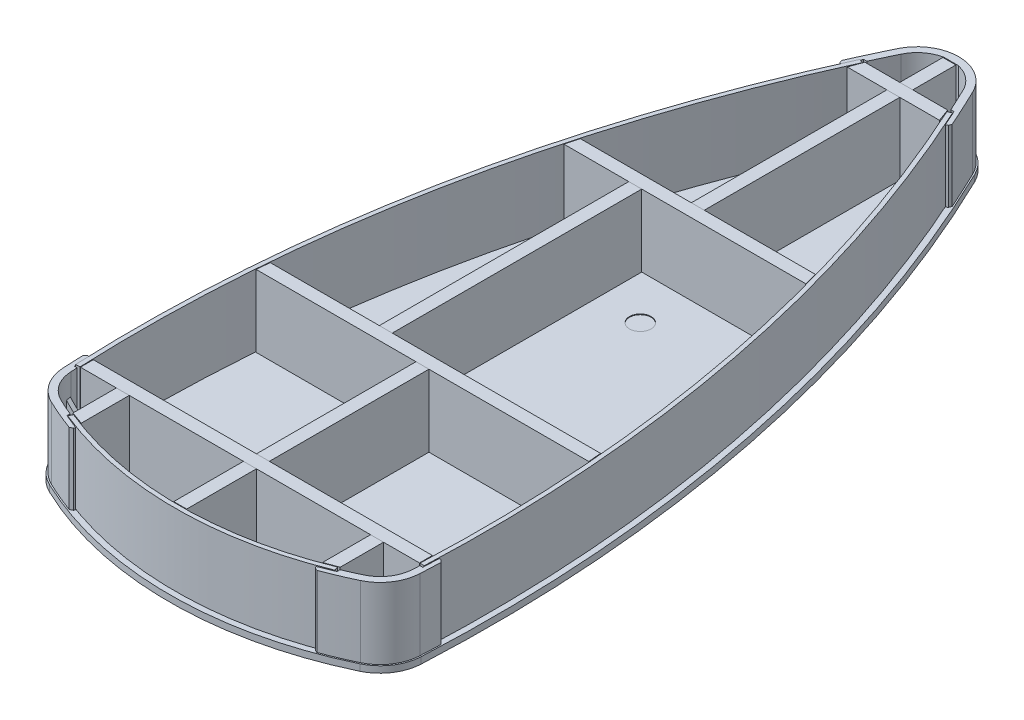
from build123d import *

# Parameters (mm, degrees)
BOSS_EXTRUDE1_DEPTH   = 9
SKETCH2_R             = 15
CUT_EXTRUDE1_DEPTH    = 1
SKETCH3_W             = 18
SKETCH3_H             = 60
BOSS_EXTRUDE2_DEPTH   = 100
BOSS_EXTRUDE3_DEPTH   = 100
BOSS_EXTRUDE3_2_DEPTH = 100
SKETCH4_W             = 471.672956284
SKETCH4_H             = 18
BOSS_EXTRUDE3_3_DEPTH = 100
BOSS_EXTRUDE3_4_DEPTH = 100
BOSS_EXTRUDE4_DEPTH   = 100
BOSS_EXTRUDE4_2_DEPTH = 100
SKETCH5_W             = 18
SKETCH5_H             = 97
BOSS_EXTRUDE4_3_DEPTH = 100
SKETCH5_H_2           = 222
BOSS_EXTRUDE4_4_DEPTH = 100
SKETCH5_H_3           = 272
BOSS_EXTRUDE4_5_DEPTH = 100
SKETCH5_H_4           = 347
BOSS_EXTRUDE4_6_DEPTH = 100
EXTRUDE_THIN1_DEPTH   = 100
EXTRUDE_THIN1_2_DEPTH = 100
EXTRUDE_THIN1_3_DEPTH = 100
BOSS_EXTRUDE5_DEPTH   = 99
CHAMFER1_SIZE         = 3
CHAMFER1_SIZE_2       = 3.015128498
BOSS_EXTRUDE9_START   = -50
SKETCH9_W             = 6
SKETCH9_H             = 13.286366455
BOSS_EXTRUDE9_DEPTH   = 20
CHAMFER3_SIZE         = 13
CUT_EXTRUDE2_REACH    = 626.467
SKETCH10_W            = 4
SKETCH10_H            = 10
BOSS_EXTRUDE8_DEPTH   = 99
CHAMFER2_SIZE         = 3
CHAMFER2_SIZE_2       = 3.128152287
BOSS_EXTRUDE10_START  = -50
SKETCH11_W            = 12
SKETCH11_H            = 6
SKETCH11_W_2          = 6
SKETCH11_H_2          = 12
BOSS_EXTRUDE10_DEPTH  = 20
CHAMFER4_SIZE         = 12
SKETCH12_W            = 4
SKETCH12_H            = 10
CUT_EXTRUDE3_DEPTH    = 6
SKETCH13_W            = 4
SKETCH13_H            = 10
CUT_EXTRUDE4_DEPTH    = 6


with BuildPart() as part:
    # Sketch1 → Boss-Extrude1 (new body)
    with BuildSketch(Plane(origin=(0, 0, 0), x_dir=(1, 0, 0), z_dir=(0, 1, 0))):
        with BuildLine():
            ThreePointArc((-54.052143505, 516.045456082), (0, 550), (54.052143505, 516.045456082))
            ThreePointArc((54.052143505, 516.045456082), (212.411110101, 45.380156813), (249.928432165, -449.792375526))
            ThreePointArc((249.928432165, -449.792375526), (239.970710869, -480.073057321), (215.909090909, -500.980337113))
            ThreePointArc((215.909090909, -500.980337113), (0, -550), (-215.909090909, -500.980337113))
            ThreePointArc((-215.909090909, -500.980337113), (-239.970710869, -480.073057321), (-249.928432165, -449.792375526))
            ThreePointArc((-249.928432165, -449.792375526), (-212.411110101, 45.380156813), (-54.052143505, 516.045456082))
        make_face()
    extrude(amount=-BOSS_EXTRUDE1_DEPTH)

    # Sketch2 → Cut-Extrude1 (cut)
    with BuildSketch(Plane(origin=(0, 0, 0), x_dir=(1, 0, 0), z_dir=(0, 1, 0))):
        with Locations(Location((0, 105, 0), (0, 0, 270))):
            Circle(SKETCH2_R)
        with Locations(Location((0, -120, 0), (0, 0, 270))):
            Circle(SKETCH2_R)
    extrude(amount=-CUT_EXTRUDE1_DEPTH, mode=Mode.SUBTRACT)


with BuildPart() as body_2:
    # Sketch3 → Boss-Extrude2 (new body)
    with BuildSketch(Plane(origin=(0, 0, 0), x_dir=(1, 0, 0), z_dir=(0, 1, 0))):
        with Locations((0, 505)):
            Rectangle(SKETCH3_W, SKETCH3_H)
    extrude(amount=BOSS_EXTRUDE2_DEPTH)


with BuildPart() as body_3:
    # Sketch4 → Boss-Extrude3 (new body)
    with BuildSketch(Plane(origin=(0, 0, 0), x_dir=(1, 0, 0), z_dir=(0, 1, 0))):
        Polygon((-57.641979484, 475), (57.641979484, 475), (64.1934437, 457), (-64.1934437, 457), align=None)
    extrude(amount=BOSS_EXTRUDE3_DEPTH)


with BuildPart() as body_4:
    # Sketch4 → Boss-Extrude3 2 (new body)
    with BuildSketch(Plane(origin=(0, 0, 0), x_dir=(1, 0, 0), z_dir=(0, 1, 0))):
        Polygon((-229.811806881, -180), (229.811806881, -180), (231.386602824, -198), (-231.386602824, -198), align=None)
    extrude(amount=BOSS_EXTRUDE3_2_DEPTH)


with BuildPart() as body_5:
    # Sketch4 → Boss-Extrude3 3 (new body)
    with BuildSketch(Plane(origin=(0, 0, 0), x_dir=(1, 0, 0), z_dir=(0, 1, 0))):
        with Locations((0, -429)):
            Rectangle(SKETCH4_W, SKETCH4_H)
    extrude(amount=BOSS_EXTRUDE3_3_DEPTH)


with BuildPart() as body_6:
    # Sketch4 → Boss-Extrude3 4 (new body)
    with BuildSketch(Plane(origin=(0, 0, 0), x_dir=(1, 0, 0), z_dir=(0, 1, 0))):
        Polygon((-163.354493959, 185), (163.354493959, 185), (168.177579423, 167), (-168.177579423, 167), align=None)
    extrude(amount=BOSS_EXTRUDE3_4_DEPTH)


with BuildPart() as body_7:
    # Sketch5 → Boss-Extrude4 (new body)
    with BuildSketch(Plane(origin=(0, 0, 0), x_dir=(1, 0, 0), z_dir=(0, 1, 0))):
        Polygon((-185.836478142, -438), (-167.836478142, -438), (-167.836478142, -504.892797934), (-185.836478142, -498.341333717), align=None)
    extrude(amount=BOSS_EXTRUDE4_DEPTH)


with BuildPart() as body_8:
    # Sketch5 → Boss-Extrude4 2 (new body)
    with BuildSketch(Plane(origin=(0, 0, 0), x_dir=(1, 0, 0), z_dir=(0, 1, 0))):
        Polygon((167.836478142, -438), (185.836478142, -438), (185.836478142, -498.341333717), (167.836478142, -504.892797934), align=None)
    extrude(amount=BOSS_EXTRUDE4_2_DEPTH)


with BuildPart() as body_9:
    # Sketch5 → Boss-Extrude4 3 (new body)
    with BuildSketch(Plane(origin=(0, 0, 0), x_dir=(1, 0, 0), z_dir=(0, 1, 0))):
        with Locations((0, -486.5)):
            Rectangle(SKETCH5_W, SKETCH5_H)
    extrude(amount=BOSS_EXTRUDE4_3_DEPTH)


with BuildPart() as body_10:
    # Sketch5 → Boss-Extrude4 4 (new body)
    with BuildSketch(Plane(origin=(0, 0, 0), x_dir=(1, 0, 0), z_dir=(0, 1, 0))):
        with Locations((0, -309)):
            Rectangle(SKETCH5_W, SKETCH5_H_2)
    extrude(amount=BOSS_EXTRUDE4_4_DEPTH)


with BuildPart() as body_11:
    # Sketch5 → Boss-Extrude4 5 (new body)
    with BuildSketch(Plane(origin=(0, 0, 0), x_dir=(1, 0, 0), z_dir=(0, 1, 0))):
        with Locations((0, 321)):
            Rectangle(SKETCH5_W, SKETCH5_H_3)
    extrude(amount=BOSS_EXTRUDE4_5_DEPTH)


with BuildPart() as body_12:
    # Sketch5 → Boss-Extrude4 6 (new body)
    with BuildSketch(Plane(origin=(0, 0, 0), x_dir=(1, 0, 0), z_dir=(0, 1, 0))):
        with Locations((-69, -6.5)):
            Rectangle(SKETCH5_W, SKETCH5_H_4)
    extrude(amount=BOSS_EXTRUDE4_6_DEPTH)


with BuildPart() as body_13:
    # Sketch6 → Extrude-Thin1 (new body)
    with BuildSketch(Plane(origin=(0, 0, 0), x_dir=(1, 0, 0), z_dir=(0, 1, 0))):
        with BuildLine():
            ThreePointArc((-64.470022652, 475), (-207.505144561, 29.035060593), (-242.462625262, -438))
            Line((-242.462625262, -438), (-236.468201772, -437.741374739))
            ThreePointArc((-236.468201772, -437.741374739), (-201.616014688, 27.886953744), (-59.011721459, 472.508625261))
            Line((-59.011721459, 472.508625261), (-64.470022652, 475))
        make_face()
    extrude(amount=EXTRUDE_THIN1_DEPTH)


with BuildPart() as body_14:
    # Sketch6 → Extrude-Thin1 2 (new body)
    with BuildSketch(Plane(origin=(0, 0, 0), x_dir=(1, 0, 0), z_dir=(0, 1, 0))):
        with BuildLine():
            ThreePointArc((-185.836478142, -505.55329369), (0, -542), (185.836478142, -505.55329369))
            Line((185.836478142, -505.55329369), (183.570179628, -499.997765718))
            ThreePointArc((183.570179628, -499.997765718), (0, -536), (-183.570179628, -499.997765718))
            Line((-183.570179628, -499.997765718), (-185.836478142, -505.55329369))
        make_face()
    extrude(amount=EXTRUDE_THIN1_2_DEPTH)


with BuildPart() as body_15:
    # Sketch6 → Extrude-Thin1 3 (new body)
    with BuildSketch(Plane(origin=(0, 0, 0), x_dir=(1, 0, 0), z_dir=(0, 1, 0))):
        with BuildLine():
            ThreePointArc((242.462625262, -438), (207.505144561, 29.035060593), (64.470022652, 475))
            Line((64.470022652, 475), (59.011721459, 472.508625261))
            ThreePointArc((59.011721459, 472.508625261), (201.616014688, 27.886953744), (236.468201772, -437.741374739))
            Line((236.468201772, -437.741374739), (242.462625262, -438))
        make_face()
    extrude(amount=EXTRUDE_THIN1_3_DEPTH)


with BuildPart() as body_16:
    # Sketch7 → Boss-Extrude5 (new body)
    with BuildSketch(Plane(origin=(0, 0, 0), x_dir=(1, 0, 0), z_dir=(0, 1, 0))):
        with BuildLine():
            Line((-64.470022652, 475), (-72.683163437, 456.764202281))
            Line((-72.683163437, 456.764202281), (-78.153971481, 459.228175471))
            ThreePointArc((-78.153971481, 459.228175471), (-65.418012237, 487.302647919), (-52.250405388, 515.177274212))
            ThreePointArc((-52.250405388, 515.177274212), (0, 548), (52.250405388, 515.177274212))
            ThreePointArc((52.250405388, 515.177274212), (65.418012237, 487.302647919), (78.153971481, 459.228175471))
            Line((78.153971481, 459.228175471), (72.683163437, 456.764202281))
            Line((72.683163437, 456.764202281), (64.470022652, 475))
            Line((64.470022652, 475), (62.827394495, 478.647159544))
            Line((62.827394495, 478.647159544), (58.398923643, 478.647159544))
            ThreePointArc((58.398923643, 478.647159544), (50.892332052, 494.775671506), (43.241714804, 510.836364865))
            ThreePointArc((43.241714804, 510.836364865), (30.051040107, 527.429066092), (11, 536.722585545))
            Line((11, 536.722585545), (11, 537))
            Line((11, 537), (-11, 537))
            Line((-11, 537), (-11, 536.722585545))
            ThreePointArc((-11, 536.722585545), (-30.051040107, 527.429066092), (-43.241714804, 510.836364865))
            ThreePointArc((-43.241714804, 510.836364865), (-50.892332052, 494.775671506), (-58.398923643, 478.647159544))
            Line((-58.398923643, 478.647159544), (-62.827394495, 478.647159544))
            Line((-62.827394495, 478.647159544), (-64.470022652, 475))
        make_face()
    extrude(amount=BOSS_EXTRUDE5_DEPTH)

    # Chamfer1
    # the kernel refuses this chamfer: 3.015128498, 3 mm, written as the material it takes off along each edge
    with BuildSketch(Plane(origin=(78.153971481, -7.749102057, -459.228175471), x_dir=(-0.9117898859496624, 0, 0.41065703924309127), z_dir=(0, 1, 0))) as chamfer1_piece_1:
        with BuildLine():
            Line((CHAMFER1_SIZE, 0), (-0.012807713, -3.012807713))
            ThreePointArc((-0.012807713, -3.012807713), (-0.007153315, -1.549221397), (0, 0))
            Line((0, 0), (CHAMFER1_SIZE, 0))
        make_face()
    extrude(amount=114.498204113, mode=Mode.SUBTRACT)
    with BuildSketch(Plane(origin=(-78.153971481, -7.754989332, -459.228175471), x_dir=(0.4067738158230509, 0, -0.9135289063629869), z_dir=(0, 1, 0))) as chamfer1_piece_2:
        with BuildLine():
            Line((2.997751965, 0), (-CHAMFER1_SIZE_2 * 0.00425482481347, -CHAMFER1_SIZE_2 * 0.999990948211))
            Line((-CHAMFER1_SIZE_2 * 0.00425482481347, -CHAMFER1_SIZE_2 * 0.999990948211), (0, 0))
            ThreePointArc((0, 0), (1.541483441, 0.000561765), (2.997751965, 0))
        make_face()
    extrude(amount=114.509978665, mode=Mode.SUBTRACT)

    # Sketch9 → Boss-Extrude9 (add, symmetric)
    with BuildSketch(Plane(origin=(0, 99, 0), x_dir=(1, 0, 0), z_dir=(0, 1, 0)).offset(BOSS_EXTRUDE9_START)):
        with Locations((-23, 526.991665232)):
            Rectangle(SKETCH9_W, SKETCH9_H)
        with Locations((23, 526.991665232)):
            Rectangle(SKETCH9_W, SKETCH9_H)
    extrude(amount=BOSS_EXTRUDE9_DEPTH, both=True)

    # Chamfer3
    chamfer3_edges = [body_16.edges().sort_by_distance(p)[0] for p in [
        (23, 29, -520.348482004),
        (23, 69, -520.348482004),
        (-23, 29, -520.348482004),
        (-23, 69, -520.348482004),
    ]]
    chamfer(chamfer3_edges, length=CHAMFER3_SIZE)

    # Cut-Extrude2: up to this face of the body (flat: up to its plane)
    cut_extrude2_end = Plane(body_16.part.faces().sort_by_distance((26, 49, -526.042926448))[0])
    # Sketch10 → Cut-Extrude2 (cut, up to the picked face)
    with BuildSketch(Plane.ZY.offset(26), mode=Mode.PRIVATE) as cut_extrude2_sk1:
        with Locations((-528.348482004, 49)):
            Rectangle(SKETCH10_W, SKETCH10_H)
    cut_extrude2_tool1 = split(extrude(cut_extrude2_sk1.sketch, amount=-CUT_EXTRUDE2_REACH, mode=Mode.PRIVATE), bisect_by=cut_extrude2_end, keep=Keep.BOTH, mode=Mode.PRIVATE)
    add(cut_extrude2_tool1.solids().sort_by(Axis((-26, 49, -528.348482), (1, 0, 0)))[0], mode=Mode.SUBTRACT)


with BuildPart() as body_17:
    # Sketch8 → Boss-Extrude8 (new body)
    with BuildSketch(Plane(origin=(0, 0, 0), x_dir=(1, 0, 0), z_dir=(0, 1, 0))):
        with BuildLine():
            ThreePointArc((-210.727272727, -490.156809023), (-199.347696236, -495.426195913), (-187.836478142, -500.401440361))
            Line((-187.836478142, -500.401440361), (-187.836478142, -504.737422174))
            Line((-187.836478142, -504.737422174), (-185.836478142, -505.55329369))
            Line((-185.836478142, -505.55329369), (-167.318051569, -513.10762207))
            Line((-167.318051569, -513.10762207), (-169.432595527, -518.291144026))
            ThreePointArc((-169.432595527, -518.291144026), (-192.476455589, -509.300352758), (-215.045454545, -499.176415765))
            ThreePointArc((-215.045454545, -499.176415765), (-238.305020506, -478.966045299), (-247.930817759, -449.694719564))
            ThreePointArc((-247.930817759, -449.694719564), (-248.63740515, -433.971421293), (-249.22011191, -418.243044801))
            Line((-249.22011191, -418.243044801), (-243.224390312, -418.014512415))
            Line((-243.224390312, -418.014512415), (-242.462625262, -438))
            Line((-242.462625262, -438), (-242.462625262, -440))
            Line((-242.462625262, -440), (-238.371425169, -440))
            ThreePointArc((-238.371425169, -440), (-238.162420616, -444.603468298), (-237.942745732, -449.206439753))
            ThreePointArc((-237.942745732, -449.206439753), (-229.976568695, -473.430985189), (-210.727272727, -490.156809023))
        make_face()
    extrude(amount=BOSS_EXTRUDE8_DEPTH)

    # Chamfer2
    # the kernel refuses this chamfer: 3.128152287, 3.015128498, 3 mm, written as the material it takes off along each edge
    with BuildSketch(Plane(origin=(-249.22011191, -7.749102057, 418.243044801), x_dir=(0.9992743792488951, 0, -0.038088252476787175), z_dir=(0, 1, 0))) as chamfer2_piece_1:
        with BuildLine():
            Line((CHAMFER2_SIZE, 0), (-0.012807713, -3.012807713))
            ThreePointArc((-0.012807713, -3.012807713), (-0.007153315, -1.549221397), (0, 0))
            Line((0, 0), (CHAMFER2_SIZE, 0))
        make_face()
    extrude(amount=114.498204113, mode=Mode.SUBTRACT)
    with BuildSketch(Plane(origin=(-169.432595527, -8.053073768, 518.291144026), x_dir=(-0.9393177088039535, 0, -0.3430484541974954), z_dir=(0, 1, 0))) as chamfer2_piece_2:
        with BuildLine():
            Line((2.99103129, 0), (-CHAMFER2_SIZE_2 * 0.0371598407598, -CHAMFER2_SIZE_2 * 0.999309334501))
            Line((-CHAMFER2_SIZE_2 * 0.0371598407598, -CHAMFER2_SIZE_2 * 0.999309334501), (0, 0))
            ThreePointArc((0, 0), (1.539617618, 0.002243602), (2.99103129, 0))
        make_face()
    extrude(amount=115.106147536, mode=Mode.SUBTRACT)

    # Sketch11 → Boss-Extrude10 (add, symmetric)
    with BuildSketch(Plane(origin=(0, 99, 0), x_dir=(1, 0, 0), z_dir=(0, 1, 0)).offset(BOSS_EXTRUDE10_START)):
        with Locations((-231.903792557, -453)):
            Rectangle(SKETCH11_W, SKETCH11_H)
        with Locations((-200.836478142, -490.099459668)):
            Rectangle(SKETCH11_W_2, SKETCH11_H_2)
    extrude(amount=BOSS_EXTRUDE10_DEPTH, both=True)

    # Chamfer4
    # the kernel refuses this chamfer: 12 mm, written as the material it takes off along each edge
    with BuildSketch(Plane(origin=(-203.836478142, 29, 484.099459668), x_dir=(0, 0, 1), z_dir=(1, 0, 0))) as chamfer4_piece_1_section:
        Polygon((CHAMFER4_SIZE, 0), (0, -CHAMFER4_SIZE), (0, 0), align=None)
    chamfer4_piece_1 = extrude(amount=36.860195856, mode=Mode.PRIVATE)
    chamfer4_piece_1 = chamfer4_piece_1 & Plane(origin=(0, 29, 50), x_dir=(-0.43181818181818066, 0, 0.9019606742265656), z_dir=(0, -1, 0)) * Cylinder(488, 122, mode=Mode.PRIVATE)
    add(chamfer4_piece_1, mode=Mode.SUBTRACT)
    with BuildSketch(Plane(origin=(-203.836478142, 69, 484.099459668), x_dir=(0, 0, 1), z_dir=(1, 0, 0))) as chamfer4_piece_2_section:
        Polygon((CHAMFER4_SIZE, 0), (0, CHAMFER4_SIZE), (0, 0), align=None)
    chamfer4_piece_2 = extrude(amount=36.860195856, mode=Mode.PRIVATE)
    chamfer4_piece_2 = chamfer4_piece_2 & Plane(origin=(0, 69, 50), x_dir=(-0.43181818181818066, 0, 0.9019606742265656), z_dir=(0, -1, 0)) * Cylinder(488, 122, mode=Mode.PRIVATE)
    add(chamfer4_piece_2, mode=Mode.SUBTRACT)
    with BuildSketch(Plane(origin=(-225.903792557, 29, 419.139804144), x_dir=(-1, 0, 0), z_dir=(0, 0, 1))) as chamfer4_piece_3_section:
        Polygon((CHAMFER4_SIZE, 0), (0, -CHAMFER4_SIZE), (0, 0), align=None)
    chamfer4_piece_3 = extrude(amount=67.720391711, mode=Mode.PRIVATE)
    chamfer4_piece_3 = chamfer4_piece_3 & Plane(origin=(-190, 29, 446.86269666), x_dir=(-0.998807202747816, 0, 0.04882798110800245), z_dir=(0, -1, 0)) * Cylinder(48, 184, mode=Mode.PRIVATE)
    add(chamfer4_piece_3, mode=Mode.SUBTRACT)
    with BuildSketch(Plane(origin=(-225.903792557, 69, 419.139804144), x_dir=(-1, 0, 0), z_dir=(0, 0, 1))) as chamfer4_piece_4_section:
        Polygon((CHAMFER4_SIZE, 0), (0, CHAMFER4_SIZE), (0, 0), align=None)
    chamfer4_piece_4 = extrude(amount=67.720391711, mode=Mode.PRIVATE)
    chamfer4_piece_4 = chamfer4_piece_4 & Plane(origin=(-190, 69, 446.86269666), x_dir=(-0.998807202747816, 0, 0.04882798110800245), z_dir=(0, -1, 0)) * Cylinder(48, 184, mode=Mode.PRIVATE)
    add(chamfer4_piece_4, mode=Mode.SUBTRACT)

    # Sketch12 → Cut-Extrude3 (cut)
    with BuildSketch(Plane.XY.offset(456)):
        with Locations((-235.122284406, 49)):
            Rectangle(SKETCH12_W, SKETCH12_H)
    extrude(amount=-CUT_EXTRUDE3_DEPTH, mode=Mode.SUBTRACT)

    # Sketch13 → Cut-Extrude4 (cut)
    with BuildSketch(Plane.ZY.offset(203.836478142)):
        with Locations((491.389997833, 49)):
            Rectangle(SKETCH13_W, SKETCH13_H)
    extrude(amount=-CUT_EXTRUDE4_DEPTH, mode=Mode.SUBTRACT)


with BuildPart() as body_18:
    # Mirror1: mirrored copy
    add(body_17.part.mirror(Plane(origin=(0, 0, 0), x_dir=(0, 0, 1), z_dir=(1, 0, 0))))


solid = Compound([part.part, body_2.part, body_3.part, body_4.part, body_5.part, body_6.part, body_7.part, body_8.part, body_9.part, body_10.part, body_11.part, body_12.part, body_13.part, body_14.part, body_15.part, body_16.part, body_17.part, body_18.part])
